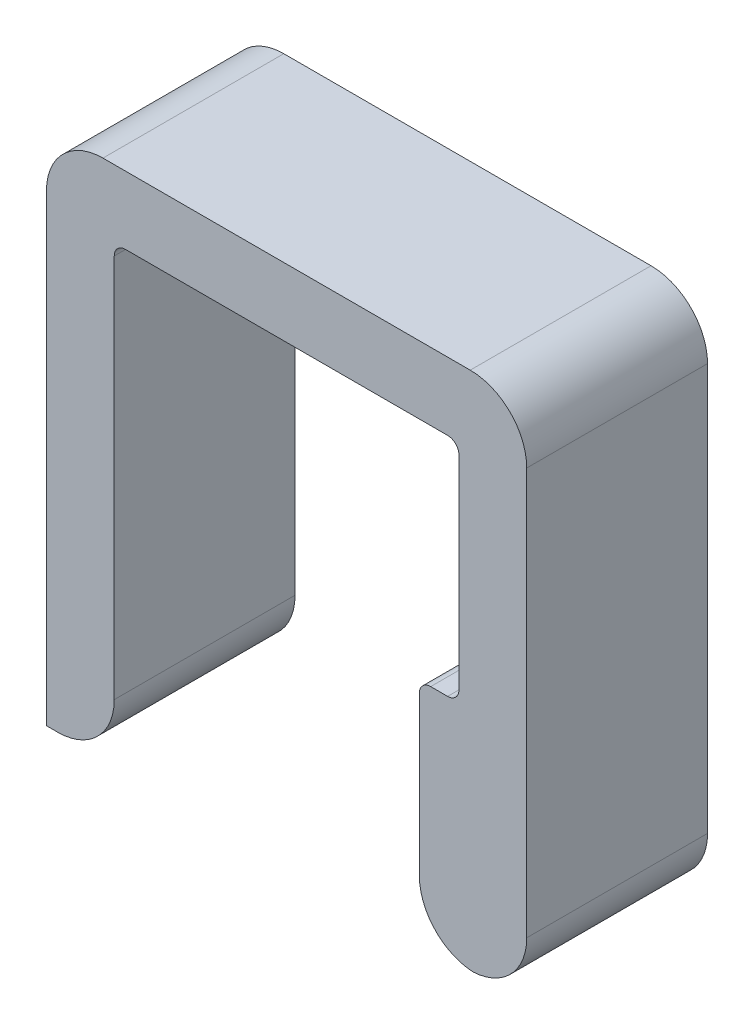
from build123d import *

# Parameters (mm, degrees)
BOSS_EXTRUDE1_DEPTH = 16
FILLET1_R           = 5
FILLET2_R           = 1


with BuildPart() as part:
    # Sketch1 → Boss-Extrude1 (new body)
    with BuildSketch(Plane.XY):
        Polygon((15.25, 0), (11.75, 0), (11.75, -20), (21.25, -20), (21.25, 26), (-21.25, 26), (-21.25, -20), (-15.25, -20), (-15.25, 20), (15.25, 20), align=None)
    extrude(amount=BOSS_EXTRUDE1_DEPTH)

    # Fillet1
    # the kernel refuses this fillet: 5 mm, written as the material it takes off along each edge
    with BuildSketch(Plane(origin=(-15.25, -20, -12.5), x_dir=(-1, 0, 0), z_dir=(0, 0, 1)), Plane(origin=(-21.25, 26, -12.5), x_dir=(1, 0, 0), z_dir=(0, 0, 1)), Plane(origin=(21.25, 26, -12.5), x_dir=(0, -1, 0), z_dir=(0, 0, 1)), Plane(origin=(21.25, -20, -12.5), x_dir=(-1, 0, 0), z_dir=(0, 0, 1)), Plane(origin=(11.75, -20, -12.5), x_dir=(0, 1, 0), z_dir=(0, 0, 1))) as fillet1_piece_1:
        with BuildLine():
            CenterArc((FILLET1_R, -FILLET1_R), FILLET1_R, 90, 90)
            Line((0, -FILLET1_R), (0, 0))
            Line((0, 0), (FILLET1_R, 0))
        make_face()
    extrude(amount=41, mode=Mode.SUBTRACT)

    # Fillet2
    fillet2_edges = [part.edges().sort_by_distance(p)[0] for p in [
        (11.75, 0, 8),
        (15.25, 0, 8),
        (15.25, 20, 8),
        (-15.25, 20, 8),
    ]]
    fillet(fillet2_edges, radius=FILLET2_R)


solid = part.part
